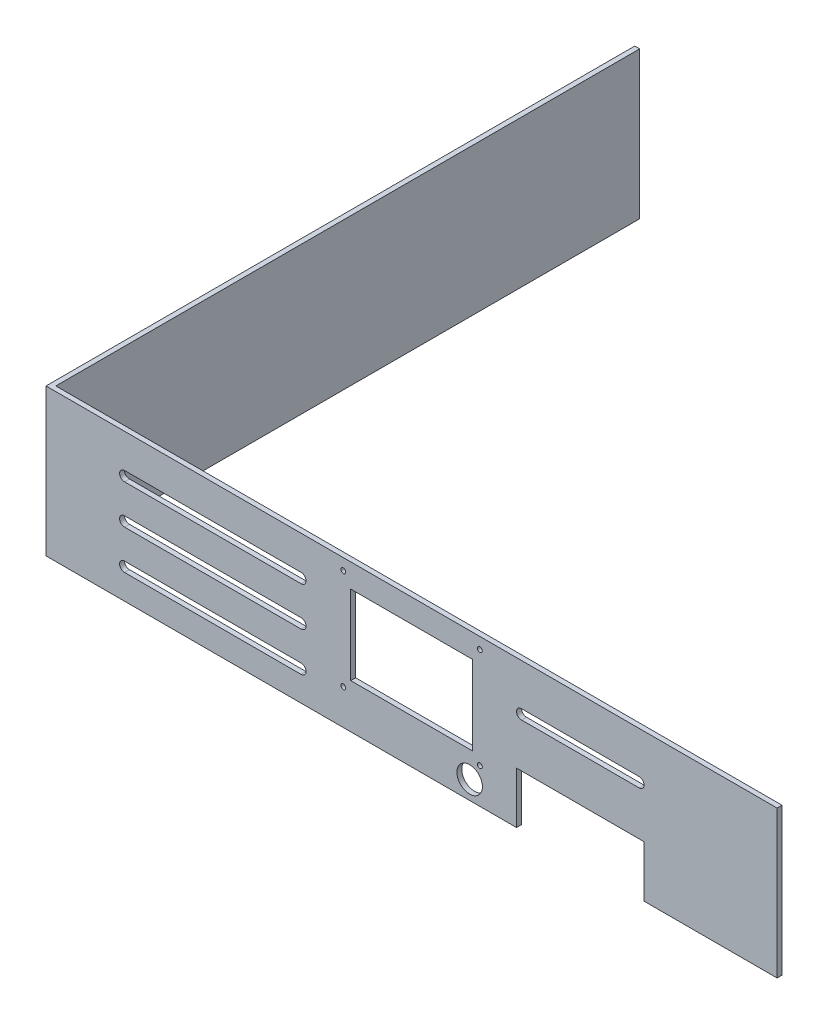
from build123d import *

# Parameters (mm, degrees)
SKETCH1_W           = 473.075
SKETCH1_H           = 95.25
BOSS_EXTRUDE1_DEPTH = 3.175
SKETCH3_W           = 78.74
SKETCH3_H           = 51.308
CUT_EXTRUDE2_DEPTH  = 242.305221983
SKETCH4_R           = 8.255
CUT_EXTRUDE3_DEPTH  = 242.305221983
SKETCH5_R           = 1.5875
CUT_EXTRUDE4_DEPTH  = 242.305221983
SKETCH6_W           = 3.175
SKETCH6_H           = 95.25
BOSS_EXTRUDE2_DEPTH = 377.825
SKETCH8_W           = 82.55
SKETCH8_H           = 33.324907577
CUT_EXTRUDE6_DEPTH  = 29.464


with BuildPart() as part:
    # Sketch1 → Boss-Extrude1 (new body)
    with BuildSketch(Plane.XY):
        Rectangle(SKETCH1_W, SKETCH1_H)
    extrude(amount=BOSS_EXTRUDE1_DEPTH)

    # Sketch3 → Cut-Extrude2 (cut, through all)
    with BuildSketch(Plane.XY.offset(3.175)):
        with Locations((0, 6.731)):
            Rectangle(SKETCH3_W, SKETCH3_H)
    extrude(amount=-CUT_EXTRUDE2_DEPTH, mode=Mode.SUBTRACT)

    # Sketch4 → Cut-Extrude3 (cut, through all)
    with BuildSketch(Plane.XY.offset(3.175)):
        with Locations((37.592, -35.814)):
            Circle(SKETCH4_R)
    extrude(amount=-CUT_EXTRUDE3_DEPTH, mode=Mode.SUBTRACT)

    # Sketch5 → Cut-Extrude4 (cut, through all)
    with BuildSketch(Plane.XY.offset(3.175)):
        with Locations((44.196, 40.259)):
            Circle(SKETCH5_R)
        with Locations((44.196, -24.765)):
            Circle(SKETCH5_R)
        with Locations((-44.196, -24.765)):
            Circle(SKETCH5_R)
        with Locations((-44.196, 40.259)):
            Circle(SKETCH5_R)
    extrude(amount=-CUT_EXTRUDE4_DEPTH, mode=Mode.SUBTRACT)

    # Sketch6 → Boss-Extrude2 (add)
    with BuildSketch(Plane(origin=(0, 0, 0), x_dir=(-1, 0, 0), z_dir=(0, 0, -1))):
        with Locations((234.95, 0)):
            Rectangle(SKETCH6_W, SKETCH6_H)
    extrude(amount=BOSS_EXTRUDE2_DEPTH)

    # Sketch8 → Cut-Extrude6 (cut)
    with BuildSketch(Plane.XY.offset(3.175)):
        with BuildLine():
            Line((-71.4375, -25.131374439), (-185.7375, -25.131374439))
            ThreePointArc((-185.7375, -25.131374439), (-188.9125, -28.306374439), (-185.7375, -31.481374439))
            Line((-185.7375, -31.481374439), (-71.4375, -31.481374439))
            ThreePointArc((-71.4375, -31.481374439), (-68.2625, -28.306374439), (-71.4375, -25.131374439))
        make_face()
        with BuildLine():
            Line((-71.4375, 0.268625561), (-185.7375, 0.268625561))
            ThreePointArc((-185.7375, 0.268625561), (-188.9125, -2.906374439), (-185.7375, -6.081374439))
            Line((-185.7375, -6.081374439), (-71.4375, -6.081374439))
            ThreePointArc((-71.4375, -6.081374439), (-68.2625, -2.906374439), (-71.4375, 0.268625561))
        make_face()
        with BuildLine():
            Line((-71.4375, 25.668625561), (-185.7375, 25.668625561))
            ThreePointArc((-185.7375, 25.668625561), (-188.9125, 22.493625561), (-185.7375, 19.318625561))
            Line((-185.7375, 19.318625561), (-71.4375, 19.318625561))
            ThreePointArc((-71.4375, 19.318625561), (-68.2625, 22.493625561), (-71.4375, 25.668625561))
        make_face()
        with BuildLine():
            Line((147.32, 20.624907577), (71.12, 20.624907577))
            ThreePointArc((71.12, 20.624907577), (67.945, 17.449907577), (71.12, 14.274907577))
            Line((71.12, 14.274907577), (147.32, 14.274907577))
            ThreePointArc((147.32, 14.274907577), (150.495, 17.449907577), (147.32, 20.624907577))
        make_face()
        with Locations((109.22, -30.962546212)):
            Rectangle(SKETCH8_W, SKETCH8_H)
    extrude(amount=-CUT_EXTRUDE6_DEPTH, mode=Mode.SUBTRACT)


solid = part.part
